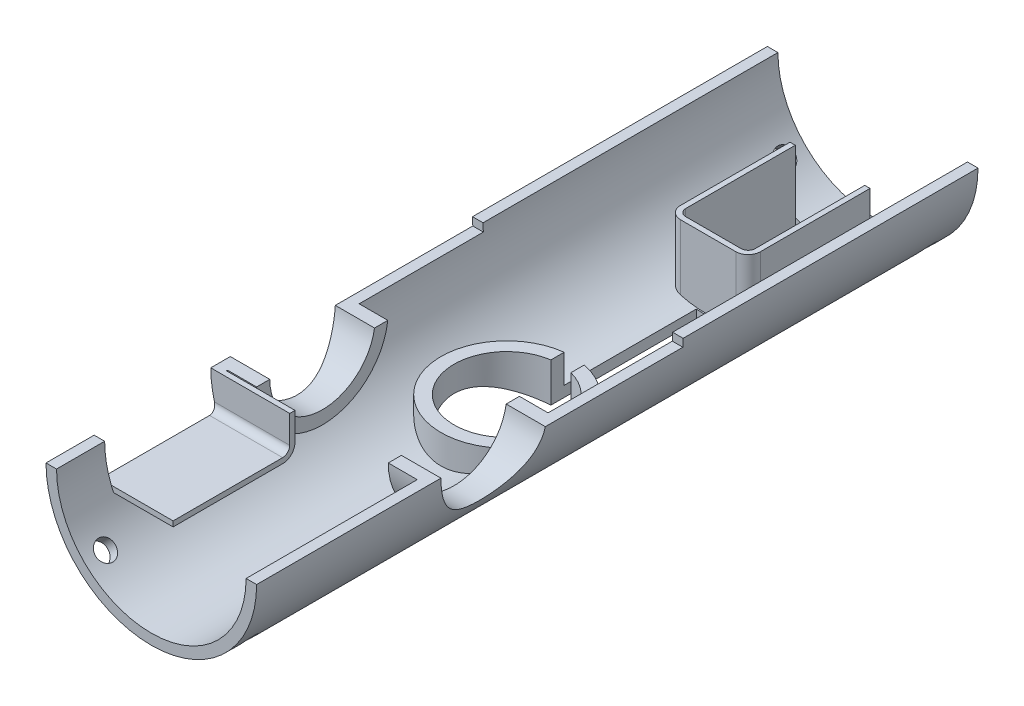
from build123d import *
from build123d.topology import SkipClean

# Parameters (mm, degrees)
SKETCH1_R                 = 20.000000000000004
SKETCH1_R_2               = 18.000000000000004
BOSS_EXTRUDE1_DEPTH       = 30
SKETCH2_R                 = 10.000000000000005
CUT_EXTRUDE1_DEPTH        = 20
SKETCH3_W                 = 3
SKETCH3_H                 = 14.18919425162652
CUT_EXTRUDE2_DEPTH        = 25
BOSS_EXTRUDE2_START       = 22.5
BOSS_EXTRUDE2_DEPTH       = 22.5
BOSS_EXTRUDE3_START       = 32
SKETCH5_R                 = 20
SKETCH5_R_2               = 18.000000000000004
BOSS_EXTRUDE3_DEPTH       = 32
SKETCH7_R                 = 20
SKETCH7_R_2               = 18.000000000000004
BOSS_EXTRUDE5_DEPTH       = 52.5
SKETCH8_R                 = 10.000000000000002
CUT_EXTRUDE3_DEPTH        = 22.500000000000004
CUT_EXTRUDE7_DEPTH        = 94.84162204766672
BOSS_EXTRUDE6_REACH       = 92.898
SKETCH17_R                = 12.500000000000002
SKETCH17_R_2              = 9.999999999999961
BOSS_EXTRUDE7_REACH       = 89.214
BOSS_EXTRUDE7_END_RADIUS  = 18.000000000000004
CUT_EXTRUDE9_DEPTH        = 5
BOSS_EXTRUDE8_REACH       = 141.889
CUT_EXTRUDE10_START       = -9.140015981
CUT_EXTRUDE10_DEPTH       = 9.140015981
BOSS_EXTRUDE9_START       = -18
BOSS_EXTRUDE9_DEPTH       = 18
CUT_EXTRUDE12_START       = -5
CUT_EXTRUDE12_DEPTH       = 5
CUT_EXTRUDE13_DEPTH       = 93.50158778794676
CUT_EXTRUDE14_START       = -20.999999999999996
CUT_EXTRUDE14_DEPTH       = 20.999999999999996
BOSS_EXTRUDE10_REACH      = 92.898
BOSS_EXTRUDE10_END_RADIUS = 18.000000000000004
SKETCH29_R                = 12.500000000000007
SKETCH29_R_2              = 10.000000000000005
SKETCH30_W                = 4.0000000000000036
SKETCH30_H                = 3.5793485997430934
CUT_EXTRUDE15_DEPTH       = 35.50000000000001
SKETCH32_W                = 28.000000000000007
SKETCH32_H                = 3
CUT_EXTRUDE17_DEPTH       = 86
CUT_EXTRUDE18_REACH       = 97.591
CUT_EXTRUDE18_END_RADIUS  = 18.000000000000004
SKETCH33_R                = 1.875000000000003
CIRPATTERN3_COUNT         = 4
MIRROR3_COPY_1_REACH      = 97.591
MIRROR3_COPY_1_END_RADIUS = 18.000000000000004
MIRROR3_COPY_1_SKETCH_R   = 1.875000000000003
MIRROR3_COPY_2_REACH      = 97.591
MIRROR3_COPY_2_END_RADIUS = 18.000000000000004
MIRROR3_COPY_2_SKETCH_R   = 1.875000000000003
MIRROR3_COPY_3_REACH      = 97.591
MIRROR3_COPY_3_END_RADIUS = 18.000000000000004
MIRROR3_COPY_3_SKETCH_R   = 1.875000000000003
CUT_EXTRUDE19_DEPTH       = 140


# Read off the part's stored shape, not the designer's step: Boss-Extrude9
with BuildPart() as part:
    # Sketch1 → Boss-Extrude1 (new body)
    with BuildSketch(Plane.XY):
        Circle(SKETCH1_R)
        Circle(SKETCH1_R_2, mode=Mode.SUBTRACT)
    extrude(amount=BOSS_EXTRUDE1_DEPTH)

    # Sketch2 → Cut-Extrude1 (cut, symmetric)
    with BuildSketch(Plane(origin=(0, 0, 0), x_dir=(1, 0, 0), z_dir=(0, 1, 0))):
        with Locations(Location((0, -15, 0), (0, 0, 270))):
            Circle(SKETCH2_R)
    extrude(amount=CUT_EXTRUDE1_DEPTH, both=True, mode=Mode.SUBTRACT)

    # Sketch3 → Cut-Extrude2 (cut, symmetric)
    with BuildSketch(Plane(origin=(0, 0, 0), x_dir=(1, 0, 0), z_dir=(0, 1, 0))):
        with Locations((0, -0.9987420960771436)):
            Rectangle(SKETCH3_W, SKETCH3_H)
    extrude(amount=CUT_EXTRUDE2_DEPTH, both=True, mode=Mode.SUBTRACT)

    # Sketch4 → Boss-Extrude2 (add)
    with SkipClean():  # the faces are left unmerged after this step: merging them gives an invalid solid
        with BuildSketch(Plane(origin=(0, 0, 0), x_dir=(-1, 0, 0), z_dir=(0, 0, -1)).offset(BOSS_EXTRUDE2_START)):
            with BuildLine():
                ThreePointArc((1.5, -19.94367067517913), (20, -2e-15), (1.5000000000000044, 19.94367067517913))
                Line((1.5, 19.94367067517913), (1.5, 17.937391114652137))
                ThreePointArc((1.4999999999997762, 17.93739111465212), (18.000000000000004, 2.44e-15), (1.4999999999997808, -17.93739111465212))
                Line((1.5, -17.937391114652133), (1.5, -19.94367067517913))
            make_face()
            with BuildLine():
                Line((-1.5, 17.937391114652154), (-1.5, 19.94367067517913))
                ThreePointArc((-1.5, 19.94367067517913), (-20, 2.45e-15), (-1.5000000000000002, -19.94367067517913))
                Line((-1.5, -19.94367067517913), (-1.5, -17.937391114652154))
                ThreePointArc((-1.4999999999996771, -17.937391114652126), (-18.000000000000004, 2.2e-15), (-1.499999999999665, 17.937391114652126))
            make_face()
        extrude(amount=-BOSS_EXTRUDE2_DEPTH)

    # Sketch5 → Boss-Extrude3 (add)
    with SkipClean():  # the faces are left unmerged after this step: merging them gives an invalid solid
        with BuildSketch(Plane(origin=(0, 0, -22.5), x_dir=(-1, 0, 0), z_dir=(0, 0, -1)).offset(BOSS_EXTRUDE3_START)):
            Circle(SKETCH5_R)
            Circle(SKETCH5_R_2, mode=Mode.SUBTRACT)
        extrude(amount=-BOSS_EXTRUDE3_DEPTH)

    # Sketch7 → Boss-Extrude5 (add)
    with SkipClean():  # the faces are left unmerged after this step: merging them gives an invalid solid
        with BuildSketch(Plane.XY.offset(30)):
            with Locations(Location((0, 0, 0), (0, 0, 180))):
                Circle(SKETCH7_R)
            with Locations(Location((0, 0, 0), (0, 0, 180))):
                Circle(SKETCH7_R_2, mode=Mode.SUBTRACT)
        extrude(amount=BOSS_EXTRUDE5_DEPTH)

    # Sketch8 → Cut-Extrude3 (cut, symmetric)
    with SkipClean():  # the faces are left unmerged after this step: merging them gives an invalid solid
        with BuildSketch(Plane(origin=(0, 0, 0), x_dir=(0, 0, -1), z_dir=(1, 0, 0))):
            with Locations((-37.5, 0)):
                Circle(SKETCH8_R)
        extrude(amount=CUT_EXTRUDE3_DEPTH, both=True, mode=Mode.SUBTRACT)

    # Sketch14 → Cut-Extrude7 (cut, through all)
    with SkipClean():  # the faces are left unmerged after this step: merging them gives an invalid solid
        with BuildSketch(Plane(origin=(0, 20, 0), x_dir=(1, 0, 0), z_dir=(0, 1, 0))):
            Polygon((1.5, 22.5), (2.5, 22.5), (2.500000000000004, -5.317541634481452), (1.5000000000000036, -5.317541634481452), align=None)
        extrude(amount=-CUT_EXTRUDE7_DEPTH, mode=Mode.SUBTRACT)

    # Sketch17 → Boss-Extrude6 (add, up to next)
    with BuildSketch(Plane(origin=(12.5, 0, 0), x_dir=(0, 0, -1), z_dir=(1, 0, 0)), mode=Mode.PRIVATE) as boss_extrude6_sk1:
        with Locations(Location((-37.49999999999996, 3.469e-14, 0), (0, 0, 180))):
            Circle(SKETCH17_R)
        with Locations((-37.49999999999996, 3.469e-14)):
            Circle(SKETCH17_R_2, mode=Mode.SUBTRACT)
    boss_extrude6_tool1 = extrude(boss_extrude6_sk1.sketch, amount=BOSS_EXTRUDE6_REACH, mode=Mode.PRIVATE) - part.part
    boss_extrude6 = boss_extrude6_tool1.solids().sort_by_distance((12.5, 0, 25.353553))[0]
    add(boss_extrude6)

    # Boss-Extrude7: up to this cylinder (the profile starts inside it)
    with SkipClean():  # the faces are left unmerged after this step: merging them gives an invalid solid
        boss_extrude7_end = Plane(origin=(0, 0, 62.959984), z_dir=(0, 0, -1)) * Cylinder(BOSS_EXTRUDE7_END_RADIUS, 215.428, mode=Mode.PRIVATE)
        # Sketch18 → Boss-Extrude7 (add, up to the surface)
        with BuildSketch(Plane(origin=(0, 0, 0), x_dir=(0, 0, -1), z_dir=(1, 0, 0)), mode=Mode.PRIVATE) as boss_extrude7_sk1:
            with BuildLine():
                Line((-73.35998401853058, 6.599999999999998), (-52.55998401853059, 6.599999999999998))
                ThreePointArc((-52.55998401853059, 6.599999999999997), (-51.60538986392875, 6.204594154601842), (-51.20998401853059, 5.250000000000001))
                Line((-51.20998401853059, 5.250000000000001), (-51.20998401853059, -5.250000000000001))
                ThreePointArc((-51.20998401853059, -5.250000000000001), (-51.60538986392876, -6.204594154601836), (-52.55998401853059, -6.599999999999998))
                Line((-52.55998401853059, -6.599999999999998), (-73.35998401853058, -6.600000000000001))
                Line((-73.35998401853057, -6.6), (-73.35998401853058, -7.600000000000001))
                Line((-73.35998401853058, -7.600000000000001), (-52.55998401853059, -7.599999999999997))
                ThreePointArc((-52.55998401853059, -7.6), (-50.89828308274221, -6.911700935788383), (-50.20998401853059, -5.250000000000001))
                Line((-50.20998401853059, -5.250000000000001), (-50.20998401853059, 5.250000000000001))
                ThreePointArc((-50.20998401853059, 5.250000000000001), (-50.8982830827422, 6.911700935788389), (-52.55998401853059, 7.600000000000003))
                Line((-52.55998401853059, 7.600000000000001), (-73.35998401853058, 7.599999999999998))
                Line((-73.35998401853058, 7.599999999999998), (-73.35998401853057, 6.6))
            make_face()
        boss_extrude7_tool1 = extrude(boss_extrude7_sk1.sketch, amount=-BOSS_EXTRUDE7_REACH, mode=Mode.PRIVATE) & boss_extrude7_end
        add(boss_extrude7_tool1.solids().sort_by_distance((0, 6.876941, 62.959984))[0])

    # Sketch19 → Cut-Extrude9 (cut)
    with SkipClean():  # the faces are left unmerged after this step: merging them gives an invalid solid
        with BuildSketch(Plane(origin=(0, 0, 0), x_dir=(0, 0, -1), z_dir=(1, 0, 0))):
            with BuildLine():
                Line((-50.20998401853059, -5.250000000000001), (-50.20998401853059, 5.250000000000001))
                ThreePointArc((-50.20998401853059, 5.250000000000001), (-50.8982830827422, 6.911700935788389), (-52.55998401853059, 7.6000000000000005))
                Line((-52.55998401853059, 7.6000000000000005), (-73.35998401853058, 7.599999999999998))
                Line((-73.35998401853058, 7.599999999999998), (-73.35998401853058, 6.599999999999998))
                Line((-73.35998401853058, 6.599999999999998), (-52.55998401853059, 6.599999999999998))
                ThreePointArc((-52.55998401853059, 6.599999999999998), (-51.60538986392875, 6.204594154601841), (-51.20998401853059, 5.250000000000001))
                Line((-51.20998401853059, 5.250000000000001), (-51.20998401853059, -5.250000000000001))
                ThreePointArc((-51.20998401853059, -5.250000000000001), (-51.60538986392876, -6.204594154601838), (-52.55998401853059, -6.599999999999998))
                Line((-52.55998401853059, -6.599999999999998), (-73.35998401853058, -6.600000000000001))
                Line((-73.35998401853058, -6.600000000000001), (-73.35998401853058, -7.600000000000001))
                Line((-73.35998401853058, -7.600000000000001), (-52.55998401853059, -7.599999999999997))
                ThreePointArc((-52.55998401853059, -7.599999999999997), (-50.89828308274221, -6.911700935788385), (-50.20998401853059, -5.250000000000001))
            make_face()
        extrude(amount=-CUT_EXTRUDE9_DEPTH, mode=Mode.SUBTRACT)

    # Sketch20 → Boss-Extrude8 (add, up to next)
    with BuildSketch(Plane.XY.offset(82.49999999999999), mode=Mode.PRIVATE) as boss_extrude8_sk1:
        with BuildLine():
            Line((-16.746342884343438, -6.600000000000001), (-16.746342884343438, 6.599999999999998))
            ThreePointArc((-16.746342884343434, 6.600000000000001), (-18, 2.2e-15), (-16.746342884343438, -6.599999999999998))
        make_face()
    boss_extrude8_tool1 = extrude(boss_extrude8_sk1.sketch, amount=-BOSS_EXTRUDE8_REACH, mode=Mode.PRIVATE) - part.part
    add(boss_extrude8_tool1.solids().sort_by_distance((-17.249333, 0, 82.5))[0])

    # Sketch21 → Cut-Extrude10 (cut)
    with SkipClean():  # the faces are left unmerged after this step: merging them gives an invalid solid
        with BuildSketch(Plane.XY.offset(82.49999999999999).offset(CUT_EXTRUDE10_START)):
            with BuildLine():
                ThreePointArc((-16.746342884343434, 6.600000000000001), (-18, 2.2e-15), (-16.746342884343438, -6.599999999999998))
                Line((-16.746342884343438, -6.600000000000003), (-16.746342884343438, 6.600000000000003))
            make_face()
            with BuildLine():
                Line((-16.746342884343438, 6.600000000000003), (-16.746342884343438, -6.600000000000003))
                ThreePointArc((-16.746342884343438, -6.599999999999998), (3.3590049182621122, -17.683808581838104), (18, -4.41e-15))
                ThreePointArc((18, 0), (3.3590049182621167, 17.683808581838104), (-16.746342884343434, 6.600000000000001))
            make_face()
        extrude(amount=CUT_EXTRUDE10_DEPTH, mode=Mode.SUBTRACT)

    # Boss-Extrude9 outline → Boss-Extrude9 (add)
    with SkipClean():  # the faces are left unmerged after this step: merging them gives an invalid solid
        with BuildSketch(Plane(origin=(50.804275903139434, 0, -12.243053878130752), x_dir=(0, 0, -1), z_dir=(0, 1, 0)).offset(BOSS_EXTRUDE9_START)):
            with BuildLine():
                ThreePointArc((12.856946122, 57.908219312), (11.195245186, 57.219920248), (10.506946122, 55.558219312))
                Line((10.506946122, 55.558219312), (10.506946122, 45.045105532))
                ThreePointArc((10.506946122, 45.045105532), (11.199853903, 43.391882613), (12.856917722, 42.708211121))
                Line((12.856917722, 42.708211121), (33.656945683, 42.708219312))
                Line((33.656945683, 42.708219312), (33.656945733, 43.708219312))
                Line((33.656945733, 43.708219312), (12.856917722, 43.708211121))
                ThreePointArc((12.856917722, 43.708211121), (11.905838377, 44.100111702), (11.506946122, 45.048279912))
                Line((11.506946122, 45.048279912), (11.506946122, 55.558219312))
                ThreePointArc((11.506946122, 55.558219312), (11.902351968, 56.512813466), (12.856946122, 56.908219312))
                Line((12.856946122, 56.908219312), (33.656946122, 56.908219312))
                Line((33.656946122, 56.908219312), (33.656946447, 57.908219312))
                Line((33.656946447, 57.908219312), (12.856946122, 57.908219312))
            make_face()
        extrude(amount=BOSS_EXTRUDE9_DEPTH)

    # Sketch26 → Cut-Extrude12 (cut)
    with SkipClean():  # the faces are left unmerged after this step: merging them gives an invalid solid
        with BuildSketch(Plane(origin=(0, 0, 0), x_dir=(-1, 0, 0), z_dir=(0, 1, 0)).offset(CUT_EXTRUDE12_START)):
            with BuildLine():
                Line((-8.096064781732366, -25.099971600575135), (-8.096056591348372, -45.89999956080974))
                Line((-8.096056591348372, -45.89999956080974), (-7.096056591348369, -45.89999956080974))
                Line((-7.096056591348369, -45.89999956080974), (-7.096064781732365, -25.099971600575135))
                ThreePointArc((-7.096064781732365, -25.099971600575135), (-6.704164201464376, -24.148892255031903), (-5.755995991066618, -23.75))
                Line((-5.755995991066618, -23.75), (4.753943408626532, -23.74999999996665))
                ThreePointArc((4.753943408626532, -23.74999999996665), (5.708537563243819, -24.145405845382772), (6.103943408648366, -25.100000000000065))
                Line((6.103943408648366, -25.100000000000065), (6.1039434086368125, -45.900000000000055))
                Line((6.1039434086368125, -45.900000000000055), (7.103943408636799, -45.90000032526164))
                Line((7.103943408636799, -45.90000032526164), (7.103943408636813, -25.100000000000065))
                ThreePointArc((7.103943408636813, -25.100000000000065), (6.415644344422198, -23.438299064204394), (4.753943408626532, -22.74999999996665))
                Line((4.753943408626532, -22.74999999996665), (-5.759170371377929, -22.75))
                ThreePointArc((-5.759170371377929, -22.75), (-7.412393289818503, -23.442907780994286), (-8.096064781732366, -25.099971600575135))
            make_face()
        extrude(amount=CUT_EXTRUDE12_DEPTH, mode=Mode.SUBTRACT)

    # Sketch27 → Cut-Extrude13 (cut, through all)
    with SkipClean():  # the faces are left unmerged after this step: merging them gives an invalid solid
        with BuildSketch(Plane(origin=(-16.746342884343438, 0, 0), x_dir=(0, 0, -1), z_dir=(1, 0, 0))):
            with BuildLine():
                Line((-52.55998401853059, 6.599999999999998), (-73.35998401853058, 6.599999999999998))
                Line((-73.35998401853058, 6.599999999999998), (-73.35998401853011, -6.600000000000003))
                Line((-73.35998401853011, -6.600000000000003), (-52.55998401853059, -6.599999999999994))
                ThreePointArc((-52.55998401853059, -6.599999999999994), (-51.60538986392876, -6.2045941546018355), (-51.20998401853059, -5.250000000000001))
                Line((-51.20998401853059, -5.250000000000001), (-51.20998401853059, 5.250000000000001))
                ThreePointArc((-51.20998401853059, 5.250000000000001), (-51.60538986392875, 6.204594154601841), (-52.55998401853059, 6.599999999999998))
            make_face()
        extrude(amount=-CUT_EXTRUDE13_DEPTH, mode=Mode.SUBTRACT)

    # Sketch28 → Cut-Extrude14 (cut)
    with SkipClean():  # the faces are left unmerged after this step: merging them gives an invalid solid
        with BuildSketch(Plane(origin=(0, -5, 0), x_dir=(1, 0, 0), z_dir=(0, 1, 0)).offset(CUT_EXTRUDE14_START)):
            with BuildLine():
                Line((-6.1039434086368125, 45.900000000000055), (7.096056591348369, 45.89999956080974))
                Line((7.096056591348369, 45.89999956080974), (7.096064781732365, 25.099971600575135))
                ThreePointArc((7.096064781732365, 25.099971600575135), (6.704164201464375, 24.148892255031907), (5.755995991066618, 23.75))
                Line((5.755995991066618, 23.75), (-4.753943408626532, 23.749999999972427))
                ThreePointArc((-4.753943408626532, 23.749999999972427), (-5.708537563247905, 24.145405845378683), (-6.103943408648366, 25.100000000000065))
                Line((-6.103943408648366, 25.100000000000065), (-6.1039434086368125, 45.900000000000055))
            make_face()
        extrude(amount=CUT_EXTRUDE14_DEPTH, mode=Mode.SUBTRACT)

    # Mirror1: Boss-Extrude6 across plane
    with SkipClean():  # the faces are left unmerged after this step: merging them gives an invalid solid
        add(boss_extrude6.mirror(Plane(origin=(0, 0, 0), x_dir=(0, 0, 1), z_dir=(1, 0, 0))))

    # Boss-Extrude10: up to this cylinder (the profile starts inside it)
    with SkipClean():  # the faces are left unmerged after this step: merging them gives an invalid solid
        boss_extrude10_end = Plane(origin=(0, 0, 27.058675), z_dir=(0, 0, -1)) * Cylinder(BOSS_EXTRUDE10_END_RADIUS, 222.796, mode=Mode.PRIVATE)
        # Sketch29 → Boss-Extrude10 (add, up to the surface)
        with BuildSketch(Plane(origin=(0, 12.5, 0), x_dir=(1, 0, 0), z_dir=(0, 1, 0)), mode=Mode.PRIVATE) as boss_extrude10_sk1:
            with Locations(Location((-7.98e-14, -14.999999999999652, 0), (0, 0, 96.892101339))):
                Circle(SKETCH29_R)
            with Locations(Location((-7.98e-14, -14.999999999999652, 0), (0, 0, 270))):
                Circle(SKETCH29_R_2, mode=Mode.SUBTRACT)
        boss_extrude10_tool1 = extrude(boss_extrude10_sk1.sketch, amount=BOSS_EXTRUDE10_REACH, mode=Mode.PRIVATE) & boss_extrude10_end
        boss_extrude10 = boss_extrude10_tool1.solids().sort_by_distance((1.457573, 12.5, 27.058675))[0]
        add(boss_extrude10)

    # Mirror2: Boss-Extrude10 across plane
    with SkipClean():  # the faces are left unmerged after this step: merging them gives an invalid solid
        add(boss_extrude10.mirror(Plane.ZX))

    # Sketch30 → Cut-Extrude15 (cut, symmetric)
    with SkipClean():  # the faces are left unmerged after this step: merging them gives an invalid solid
        with BuildSketch(Plane(origin=(0, -12.5, 0), x_dir=(1, 0, 0), z_dir=(0, 1, 0))):
            with Locations((0.5000000000000021, -3.5278673346099048)):
                Rectangle(SKETCH30_W, SKETCH30_H)
        extrude(amount=CUT_EXTRUDE15_DEPTH, both=True, mode=Mode.SUBTRACT)

    # Sketch32 → Cut-Extrude17 (cut)
    with SkipClean():  # the faces are left unmerged after this step: merging them gives an invalid solid
        with BuildSketch(Plane(origin=(20, 0, 0), x_dir=(0, 0, -1), z_dir=(1, 0, 0))):
            with Locations((-15.5, 0)):
                Rectangle(SKETCH32_W, SKETCH32_H)
        extrude(amount=-CUT_EXTRUDE17_DEPTH, mode=Mode.SUBTRACT)

    # Cut-Extrude18: up to this cylinder (the profile starts outside it)
    with SkipClean():  # the faces are left unmerged after this step: merging them gives an invalid solid
        cut_extrude18_end = Plane(origin=(0, 0, -50.5), z_dir=(0, 0, -1)) * Cylinder(CUT_EXTRUDE18_END_RADIUS, 232.182, mode=Mode.PRIVATE)
        # Sketch33 → Cut-Extrude18 (cut, up to the surface)
        with BuildSketch(Plane(origin=(-14.142135623730981, -14.142135623730931, 0), x_dir=(0, 0, -1), z_dir=(-0.7071067811865488, -0.7071067811865464, 0)), mode=Mode.PRIVATE) as cut_extrude18_sk1:
            with Locations(Location((50.5, 0, 0), (0, 0, 90))):
                Circle(SKETCH33_R)
        cut_extrude18_tool1 = extrude(cut_extrude18_sk1.sketch, amount=-CUT_EXTRUDE18_REACH, mode=Mode.PRIVATE) - cut_extrude18_end
        cut_extrude18 = cut_extrude18_tool1.solids().sort_by_distance((-14.142136, -14.142136, -50.5))[0]
        add(cut_extrude18, mode=Mode.SUBTRACT)

    # CirPattern3: Cut-Extrude18 ×4 about axis
    with SkipClean():  # the faces are left unmerged after this step: merging them gives an invalid solid
        cirpattern3_axis = Axis((0, 0, 30), (0, 0, -1))
        for i in range(1, CIRPATTERN3_COUNT):
            add(cut_extrude18.rotate(cirpattern3_axis, i * 360 / CIRPATTERN3_COUNT), mode=Mode.SUBTRACT)

    # Mirror3: Cut-Extrude18 across plane
    with SkipClean():  # the faces are left unmerged after this step: merging them gives an invalid solid
        add(cut_extrude18.mirror(Plane.XY.offset(13.999999999999995)), mode=Mode.SUBTRACT)

    # Mirror3 copy 1: up to this cylinder (the profile starts outside it)
    with SkipClean():  # the faces are left unmerged after this step: merging them gives an invalid solid
        mirror3_copy_1_end = Plane(origin=(0, 0, -50.5), z_dir=(0, 0, -1)) * Cylinder(MIRROR3_COPY_1_END_RADIUS, 232.182, mode=Mode.PRIVATE)
        # Mirror3 copy 1 sketch → Mirror3 copy 1 (cut, up to the surface)
        with BuildSketch(Plane(origin=(-14.142135623730931, 14.142135623730981, 27.99999999999999), x_dir=(0, 0, 1), z_dir=(-0.7071067811865464, 0.7071067811865488, 0)), mode=Mode.PRIVATE) as mirror3_copy_1_sk1:
            with Locations((50.5, 0)):
                Circle(MIRROR3_COPY_1_SKETCH_R)
        mirror3_copy_1_tool1 = extrude(mirror3_copy_1_sk1.sketch, amount=-MIRROR3_COPY_1_REACH, mode=Mode.PRIVATE) - mirror3_copy_1_end
        add(mirror3_copy_1_tool1.solids().sort_by_distance((-14.142136, -14.142136, -50.5))[0], mode=Mode.SUBTRACT)

    # Mirror3 copy 2: up to this cylinder (the profile starts outside it)
    with SkipClean():  # the faces are left unmerged after this step: merging them gives an invalid solid
        mirror3_copy_2_end = Plane(origin=(0, 0, -50.5), z_dir=(0, 0, -1)) * Cylinder(MIRROR3_COPY_2_END_RADIUS, 232.182, mode=Mode.PRIVATE)
        # Mirror3 copy 2 sketch → Mirror3 copy 2 (cut, up to the surface)
        with BuildSketch(Plane(origin=(14.14213562373098, 14.142135623730933, 27.99999999999999), x_dir=(0, 0, 1), z_dir=(0.7071067811865487, 0.7071067811865465, 0)), mode=Mode.PRIVATE) as mirror3_copy_2_sk1:
            with Locations((50.5, 0)):
                Circle(MIRROR3_COPY_2_SKETCH_R)
        mirror3_copy_2_tool1 = extrude(mirror3_copy_2_sk1.sketch, amount=-MIRROR3_COPY_2_REACH, mode=Mode.PRIVATE) - mirror3_copy_2_end
        add(mirror3_copy_2_tool1.solids().sort_by_distance((-14.142136, -14.142136, -50.5))[0], mode=Mode.SUBTRACT)

    # Mirror3 copy 3: up to this cylinder (the profile starts outside it)
    with SkipClean():  # the faces are left unmerged after this step: merging them gives an invalid solid
        mirror3_copy_3_end = Plane(origin=(0, 0, -50.5), z_dir=(0, 0, -1)) * Cylinder(MIRROR3_COPY_3_END_RADIUS, 232.182, mode=Mode.PRIVATE)
        # Mirror3 copy 3 sketch → Mirror3 copy 3 (cut, up to the surface)
        with BuildSketch(Plane(origin=(14.142135623730933, -14.14213562373098, 27.99999999999999), x_dir=(0, 0, 1), z_dir=(0.7071067811865465, -0.7071067811865487, 0)), mode=Mode.PRIVATE) as mirror3_copy_3_sk1:
            with Locations((50.5, 0)):
                Circle(MIRROR3_COPY_3_SKETCH_R)
        mirror3_copy_3_tool1 = extrude(mirror3_copy_3_sk1.sketch, amount=-MIRROR3_COPY_3_REACH, mode=Mode.PRIVATE) - mirror3_copy_3_end
        add(mirror3_copy_3_tool1.solids().sort_by_distance((-14.142136, -14.142136, -50.5))[0], mode=Mode.SUBTRACT)

    # Sketch34 → Cut-Extrude19 (cut)
    with SkipClean():  # the faces are left unmerged after this step: merging them gives an invalid solid
        with BuildSketch(Plane(origin=(0, 0, -54.5), x_dir=(-1, 0, 0), z_dir=(0, 0, -1))):
            Polygon((-20, 0), (20, 0), (20, 38.637112598391646), (-21.724777920202506, 38.637112598391646), align=None)
        extrude(amount=-CUT_EXTRUDE19_DEPTH, mode=Mode.SUBTRACT)


solid = part.part
